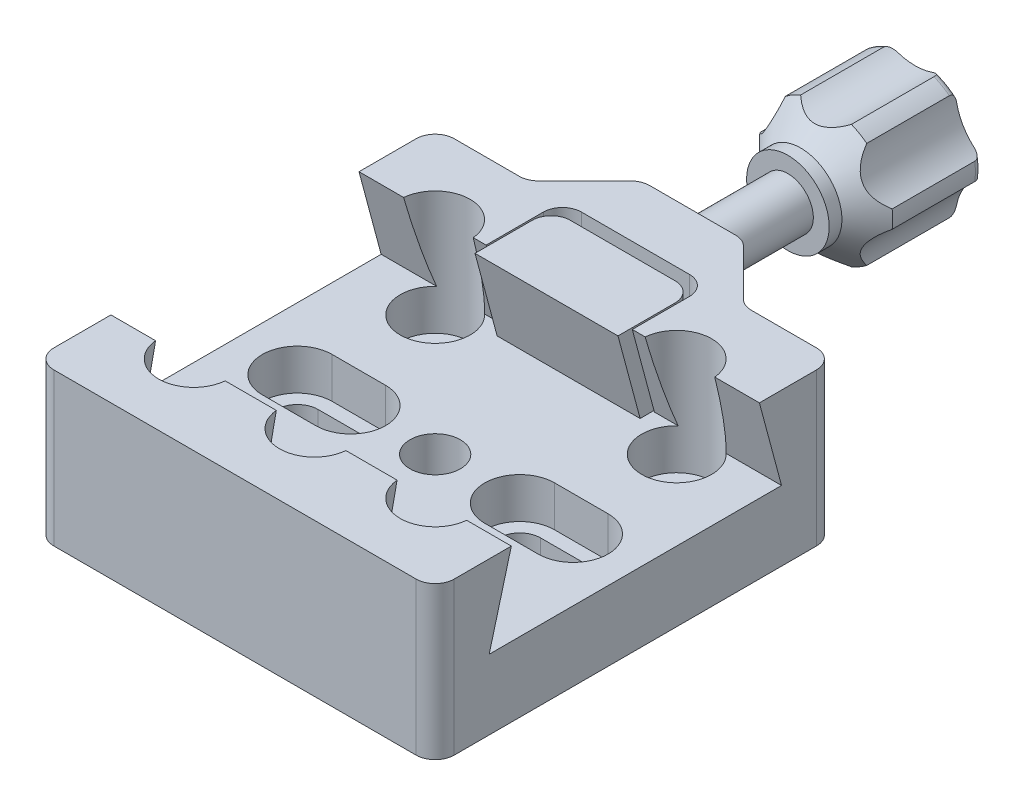
from build123d import *

# Parameters (mm, degrees)
BOSS_EXTRUDE1_DEPTH                            = 31.5
BOSS_EXTRUDE2_DEPTH                            = 24
FILLET1_R                                      = 3
SKETCH3_R                                      = 4
BOSS_EXTRUDE3_DEPTH                            = 15
SKETCH5_R                                      = 8.5
CUT_EXTRUDE1_DEPTH                             = 18
CIRPATTERN1_COUNT                              = 6
FILLET2_R                                      = 1
CUT_EXTRUDE2_DEPTH                             = 13
BOSS_EXTRUDE4_DEPTH                            = 13
CUT_EXTRUDE3_DEPTH                             = 30
FILLET3_R                                      = 3
F_3_8_16_TAPPED_HOLE1_D                        = 7.9375
CBORE_FOR_M6_HEX_SOCKET_HEAD_CAP_SCR_2_COUNT   = 2
CBORE_FOR_M6_HEX_SOCKET_HEAD_CAP_SCR_2_PITCH   = 38
CBORE_FOR_M6_HEX_SOCKET_HEAD_CAP_SCR_3_COUNT   = 2
CBORE_FOR_M6_HEX_SOCKET_HEAD_CAP_SCR_3_PITCH   = 53.74011537
CBORE_FOR_M6_HEX_SOCKET_HEAD_CAP_SCR_4_COUNT   = 2
CBORE_FOR_M6_HEX_SOCKET_HEAD_CAP_SCR_4_PITCH   = 42.485291572
CBORE_FOR_M6_HEX_SOCKET_HEAD_CAP_SCR_5_COUNT   = 2
CBORE_FOR_M6_HEX_SOCKET_HEAD_CAP_SCR_5_PITCH   = 38
CUT_EXTRUDE4_START                             = 30
SKETCH13_R                                     = 5.5
CUT_EXTRUDE4_DEPTH                             = 30
CBORE_START                                    = 4.6
CBORE_SLOT_FOR_M6_HEX_SOCKET_HEAD_CAP_SC_DEPTH = 6.4
CBORE_SLOT_FOR_M6_HEX_SOCKET_HEAD_CA_3_DEPTH   = 4.6


# Read off the part's stored shape, not the designer's step: CBORE SLOT for M6 Hex Socket Head Cap Screw1
with BuildPart() as part:
    # Sketch1 → Boss-Extrude1 (new, symmetric)
    with BuildSketch(Plane(origin=(0, 0, 0), x_dir=(0, 0, -1), z_dir=(1, 0, 0))):
        Polygon((-19.516660498, 24), (-31.5, 24), (-31.5, 0), (31.5, 0), (31.5, 24), (19.516660498, 24), (23, 11), (-23, 11), align=None)
    extrude(amount=BOSS_EXTRUDE1_DEPTH, both=True)

    # Sketch2 → Boss-Extrude2 (add)
    with BuildSketch(Plane(origin=(0, 24, 0), x_dir=(1, 0, 0), z_dir=(0, 1, 0))):
        Polygon((-8, 40.5), (-17, 31.5), (17, 31.5), (8, 40.5), align=None)
    extrude(amount=-BOSS_EXTRUDE2_DEPTH)

    # Fillet1
    fillet1_edges = [part.edges().sort_by_distance(p)[0] for p in [
        (-8, 12, -40.5),
        (8, 12, -40.5),
        (17, 12, -31.5),
        (-17, 12, -31.5),
    ]]
    fillet(fillet1_edges, radius=FILLET1_R)

    # Sketch3 → Boss-Extrude3 (add)
    with BuildSketch(Plane(origin=(0, 0, -40.5), x_dir=(-1, 0, 0), z_dir=(0, 0, -1))):
        with Locations((0, 17.5)):
            Circle(SKETCH3_R)
    extrude(amount=BOSS_EXTRUDE3_DEPTH)

    # Sketch4 → Revolve1 (revolve)
    with BuildSketch(Plane(origin=(0, 0, 0), x_dir=(0, 0, -1), z_dir=(1, 0, 0)), mode=Mode.PRIVATE) as revolve1_sk:
        Polygon((55.5, 24), (55.5, 17.5), (75.5, 17.5), (75.5, 28), (61.5, 28), (57.5, 24), align=None)
    revolve(revolve1_sk.sketch.rotate(Axis((0, 17.5, -55.5), (0, 0, 1)), 90), axis=Axis((0, 17.5, -55.5), (0, 0, 1)))

    # Sketch5 → Cut-Extrude1 (cut)
    with BuildSketch(Plane(origin=(0, 0, -75.5), x_dir=(-1, 0, 0), z_dir=(0, 0, -1))):
        with Locations((0, 34.708243919)):
            Circle(SKETCH5_R)
    cut_extrude1 = extrude(amount=-CUT_EXTRUDE1_DEPTH, mode=Mode.SUBTRACT)

    # CirPattern1: Cut-Extrude1 ×6 about axis
    cirpattern1_axis = Axis((0, 17.5, 0), (0, 0, 1))
    for i in range(1, CIRPATTERN1_COUNT):
        add(cut_extrude1.rotate(cirpattern1_axis, i * 360 / CIRPATTERN1_COUNT), mode=Mode.SUBTRACT)

    # Fillet2
    fillet2_edges = [part.edges().sort_by_distance(p)[0] for p in [
        (5.25, 26.59326674, -75.5),
        (10.5, 17.5, -75.5),
        (5.25, 8.40673326, -75.5),
        (-5.25, 8.40673326, -75.5),
        (-10.5, 17.5, -75.5),
        (-5.25, 26.59326674, -75.5),
    ]]
    fillet(fillet2_edges, radius=FILLET2_R)

    # Sketch6 → Cut-Extrude2 (cut)
    with BuildSketch(Plane(origin=(0, 24, 0), x_dir=(1, 0, 0), z_dir=(0, 1, 0))):
        with BuildLine():
            Line((-8.5, 31.516660498), (8.5, 31.516660498))
            ThreePointArc((8.5, 31.516660498), (10.621320344, 30.637980842), (11.5, 28.516660498))
            Line((11.5, 28.516660498), (11.5, 19.516660498))
            Line((11.5, 19.516660498), (-11.5, 19.516660498))
            Line((-11.5, 19.516660498), (-11.5, 28.516660498))
            ThreePointArc((-11.5, 28.516660498), (-10.621320344, 30.637980842), (-8.5, 31.516660498))
        make_face()
    extrude(amount=-CUT_EXTRUDE2_DEPTH, mode=Mode.SUBTRACT)

    # Sketch7 → Boss-Extrude4 (add)
    with BuildSketch(Plane(origin=(0, 24, 0), x_dir=(1, 0, 0), z_dir=(0, 1, 0))):
        with BuildLine():
            Line((-8.25, 29.516660498), (8.25, 29.516660498))
            ThreePointArc((8.25, 29.516660498), (10.371320344, 28.637980842), (11.25, 26.516660498))
            Line((11.25, 26.516660498), (11.25, 17.516660498))
            Line((11.25, 17.516660498), (-11.25, 17.516660498))
            Line((-11.25, 17.516660498), (-11.25, 26.516660498))
            ThreePointArc((-11.25, 26.516660498), (-10.371320344, 28.637980842), (-8.25, 29.516660498))
        make_face()
    extrude(amount=-BOSS_EXTRUDE4_DEPTH)

    # Sketch8 → Cut-Extrude3 (cut)
    with BuildSketch(Plane(origin=(11.25, 0, 0), x_dir=(0, 0, -1), z_dir=(1, 0, 0))):
        Polygon((17.516660498, 24), (21, 11), (17.516660498, 11), align=None)
    extrude(amount=-CUT_EXTRUDE3_DEPTH, mode=Mode.SUBTRACT)

    # Fillet3
    fillet3_edges = [part.edges().sort_by_distance(p)[0] for p in [
        (-31.5, 12, 31.5),
        (31.5, 12, 31.5),
        (31.5, 12, -31.5),
        (-31.5, 12, -31.5),
    ]]
    fillet(fillet3_edges, radius=FILLET3_R)

    # 3/8-16 Tapped Hole1 (through all)
    with Locations(Plane(origin=(0, 11, 0), x_dir=(1, 0, 0), z_dir=(0, 1, 0))):
        with Locations((0, 0)):
            Hole(F_3_8_16_TAPPED_HOLE1_D / 2)

    # Sketch12 → CBORE for M6 Hex Socket Head Cap Screw1 (revolve, cut)
    with BuildSketch(Plane(origin=(-19, 11, -19), x_dir=(0, 0, 1), z_dir=(1, 0, 0))):
        Polygon((0, 0), (0, 11), (3.3, 11), (3.3, 6.4), (5.5, 6.4), (5.5, 0), align=None)
    cbore_for_m6_hex_socket_head_cap_screw1 = revolve(axis=Axis((-19, 17.35, -19), (0, -1, 0)), mode=Mode.SUBTRACT)

    # CBORE for M6 Hex Socket Head Cap Scr 2: CBORE for M6 Hex Socket Head Cap Screw1 ×2
    with Locations(*[(i * CBORE_FOR_M6_HEX_SOCKET_HEAD_CAP_SCR_2_PITCH, 0, 0) for i in range(1, CBORE_FOR_M6_HEX_SOCKET_HEAD_CAP_SCR_2_COUNT)]):
        add(cbore_for_m6_hex_socket_head_cap_screw1, mode=Mode.SUBTRACT)

    # CBORE for M6 Hex Socket Head Cap Scr 3: CBORE for M6 Hex Socket Head Cap Screw1 ×2
    with Locations(*[Vector(0.7071067811865476, 0, 0.7071067811865475) * (i * CBORE_FOR_M6_HEX_SOCKET_HEAD_CAP_SCR_3_PITCH) for i in range(1, CBORE_FOR_M6_HEX_SOCKET_HEAD_CAP_SCR_3_COUNT)]):
        add(cbore_for_m6_hex_socket_head_cap_screw1, mode=Mode.SUBTRACT)

    # CBORE for M6 Hex Socket Head Cap Scr 4: CBORE for M6 Hex Socket Head Cap Screw1 ×2
    with Locations(*[Vector(0.44721359549995787, 0, 0.894427190999916) * (i * CBORE_FOR_M6_HEX_SOCKET_HEAD_CAP_SCR_4_PITCH) for i in range(1, CBORE_FOR_M6_HEX_SOCKET_HEAD_CAP_SCR_4_COUNT)]):
        add(cbore_for_m6_hex_socket_head_cap_screw1, mode=Mode.SUBTRACT)

    # CBORE for M6 Hex Socket Head Cap Scr 5: CBORE for M6 Hex Socket Head Cap Screw1 ×2
    with Locations(*[(0, 0, i * CBORE_FOR_M6_HEX_SOCKET_HEAD_CAP_SCR_5_PITCH) for i in range(1, CBORE_FOR_M6_HEX_SOCKET_HEAD_CAP_SCR_5_COUNT)]):
        add(cbore_for_m6_hex_socket_head_cap_screw1, mode=Mode.SUBTRACT)

    # Sketch13 → Cut-Extrude4 (cut)
    with BuildSketch(Plane(origin=(0, 11, 0), x_dir=(1, 0, 0), z_dir=(0, 1, 0)).offset(CUT_EXTRUDE4_START)):
        with Locations(Location((-19, 19, 0), (0, 0, 270))):
            Circle(SKETCH13_R)
        with Locations(Location((-19, -19, 0), (0, 0, 270))):
            Circle(SKETCH13_R)
        with Locations(Location((19, -19, 0), (0, 0, 270))):
            Circle(SKETCH13_R)
        with Locations(Location((19, 19, 0), (0, 0, 270))):
            Circle(SKETCH13_R)
        with Locations(Location((0, -19, 0), (0, 0, 270))):
            Circle(SKETCH13_R)
    extrude(amount=-CUT_EXTRUDE4_DEPTH, mode=Mode.SUBTRACT)

    # CBORE SLOT for M6 Hex Socket Head Ca 2 → CBORE SLOT for M6 Hex Socket Head Cap Screw1 (cut)
    with BuildSketch(Plane(origin=(0, 0, 0), x_dir=(1, 0, 0), z_dir=(0, 1, 0)).offset(CBORE_START)):
        with BuildLine():
            Line((13.3, -5.5), (21.7, -5.5))
            ThreePointArc((21.7, -5.5), (27.2, 0), (21.7, 5.5))
            Line((21.7, 5.5), (13.3, 5.5))
            ThreePointArc((13.3, 5.5), (7.8, 0), (13.3, -5.5))
        make_face()
        with BuildLine():
            ThreePointArc((-13.3, -5.5), (-7.8, 0), (-13.3, 5.5))
            Line((-13.3, 5.5), (-21.7, 5.5))
            ThreePointArc((-21.7, 5.5), (-27.2, 0), (-21.7, -5.5))
            Line((-21.7, -5.5), (-13.3, -5.5))
        make_face()
    extrude(amount=CBORE_SLOT_FOR_M6_HEX_SOCKET_HEAD_CAP_SC_DEPTH, mode=Mode.SUBTRACT)

    # CBORE SLOT for M6 Hex Socket Head Ca 3 o → CBORE SLOT for M6 Hex Socket Head Ca 3 (cut)
    with BuildSketch(Plane(origin=(0, 0, 0), x_dir=(1, 0, 0), z_dir=(0, 1, 0))):
        with BuildLine():
            Line((13.3, -3.3), (21.7, -3.3))
            ThreePointArc((21.7, -3.3), (25, 0), (21.7, 3.3))
            Line((21.7, 3.3), (13.3, 3.3))
            ThreePointArc((13.3, 3.3), (10, 0), (13.3, -3.3))
        make_face()
        with BuildLine():
            ThreePointArc((-13.3, -3.3), (-10, 0), (-13.3, 3.3))
            Line((-13.3, 3.3), (-21.7, 3.3))
            ThreePointArc((-21.7, 3.3), (-25, 0), (-21.7, -3.3))
            Line((-21.7, -3.3), (-13.3, -3.3))
        make_face()
    extrude(amount=CBORE_SLOT_FOR_M6_HEX_SOCKET_HEAD_CA_3_DEPTH, mode=Mode.SUBTRACT)


solid = part.part
